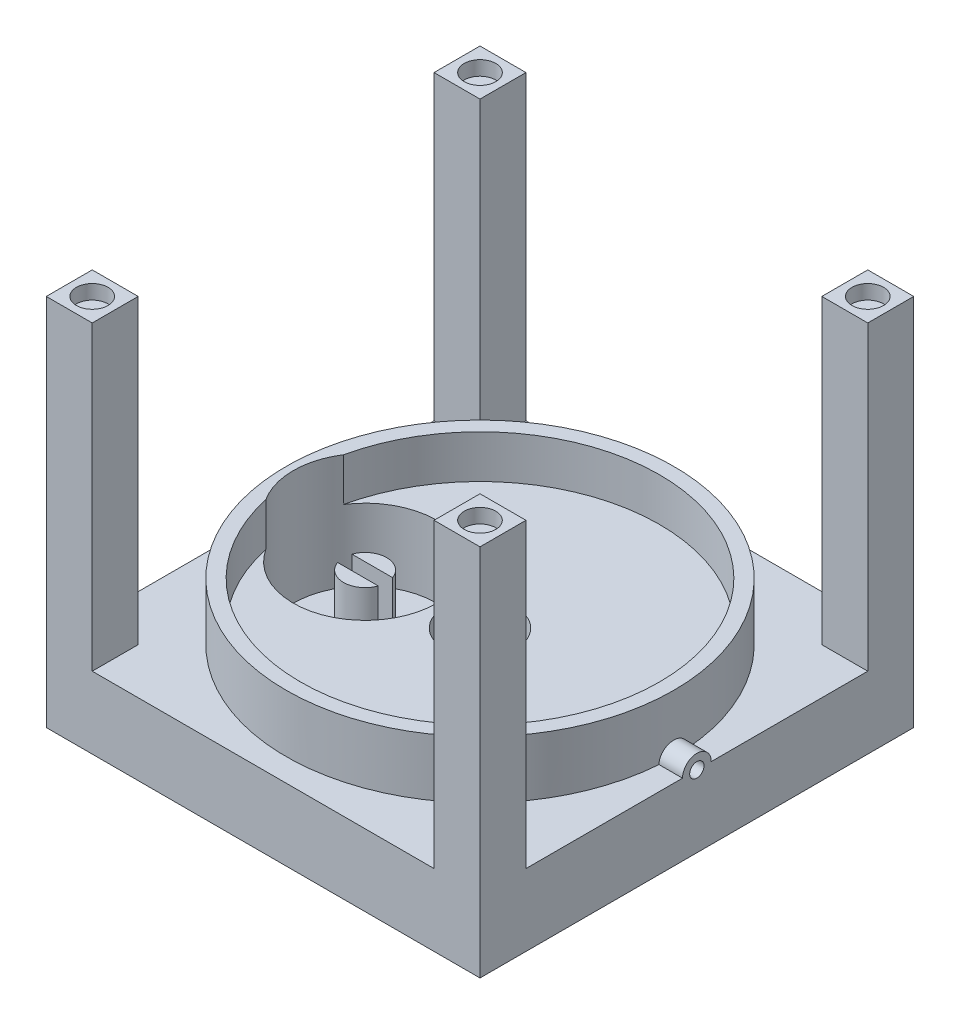
from build123d import *

# Parameters (mm, degrees)
SKETCH1_W               = 30.2
SKETCH1_H               = 30.2
BOSS_EXTRUDE1_DEPTH     = 5
SKETCH2_R               = 13.5
BOSS_EXTRUDE2_DEPTH     = 1
SKETCH3_R               = 2.5
CUT_EXTRUDE1_DEPTH      = 4.5
SKETCH4_R               = 13.5
SKETCH4_R_2             = 12.5
BOSS_EXTRUDE3_DEPTH     = 3
CUT_EXTRUDE2_DEPTH      = 5
CUT_EXTRUDE2_DEPTH_BACK = 5
SKETCH5_R               = 5
BOSS_EXTRUDE4_DEPTH     = 4.5
SKETCH7_R               = 1
SKETCH7_R_2             = 0.5
CUT_SWEEP1_START        = 4.580551388
CUT_SWEEP1_OUTLINE_R    = 0.5
CUT_SWEEP1_DEPTH        = 18.125062915
SKETCH10_R              = 2.5
CUT_EXTRUDE3_DEPTH      = 3
SKETCH12_W              = 3.2
SKETCH12_H              = 3.2
BOSS_EXTRUDE5_DEPTH     = 21
SKETCH15_R              = 1.1
CUT_EXTRUDE4_DEPTH      = 1


# Read off the part's stored shape, not the designer's step: Cut-Sweep1
with BuildPart() as part:
    # Sketch1 → Boss-Extrude1 (new body)
    with BuildSketch(Plane(origin=(0, 0, 0), x_dir=(1, 0, 0), z_dir=(0, 1, 0))):
        with Locations((7.605614303, 19.014035757)):
            Rectangle(SKETCH1_W, SKETCH1_H)
    extrude(amount=BOSS_EXTRUDE1_DEPTH)

    # Sketch2 → Boss-Extrude2 (add)
    with BuildSketch(Plane(origin=(0, 5, 0), x_dir=(1, 0, 0), z_dir=(0, 1, 0))):
        with Locations(Location((7.605614303, 19.014035757, 0), (0, 0, 270))):
            Circle(SKETCH2_R)
    extrude(amount=BOSS_EXTRUDE2_DEPTH)

    # Sketch3 → Cut-Extrude1 (cut)
    with BuildSketch(Plane(origin=(0, 6, 0), x_dir=(1, 0, 0), z_dir=(0, 1, 0))):
        with Locations(Location((7.605614303, 19.014035757, 0), (0, 0, 270))):
            Circle(SKETCH3_R)
    extrude(amount=-CUT_EXTRUDE1_DEPTH, mode=Mode.SUBTRACT)

    # Sketch4 → Boss-Extrude3 (add)
    with BuildSketch(Plane(origin=(0, 6, 0), x_dir=(1, 0, 0), z_dir=(0, 1, 0))):
        with Locations(Location((7.605614303, 19.014035757, 0), (0, 0, 270))):
            Circle(SKETCH4_R)
        with Locations(Location((7.605614303, 19.014035757, 0), (0, 0, 270))):
            Circle(SKETCH4_R_2, mode=Mode.SUBTRACT)
    extrude(amount=BOSS_EXTRUDE3_DEPTH)

    # Sketch5 → Cut-Extrude2 (cut, two sides: drawn at the far end of the back side and taken through both)
    with BuildSketch(Plane(origin=(0, 6, 0), x_dir=(1, 0, 0), z_dir=(0, 1, 0)).offset(-CUT_EXTRUDE2_DEPTH_BACK)):
        with Locations(Location((-0.394385697, 19.014035757, 0), (0, 0, 147.20617704))):
            Circle(SKETCH5_R)
    extrude(amount=CUT_EXTRUDE2_DEPTH + CUT_EXTRUDE2_DEPTH_BACK, mode=Mode.SUBTRACT)

    # Sketch6 → Boss-Extrude4 (add)
    with BuildSketch(Plane(origin=(0, 1, 0), x_dir=(1, 0, 0), z_dir=(0, 1, 0))):
        with BuildLine():
            ThreePointArc((1.019827865, 19.514035757), (-0.394385697, 20.514035757), (-1.80859926, 19.514035757))
            Line((-1.80859926, 19.514035757), (1.019827865, 19.514035757))
        make_face()
        with BuildLine():
            Line((1.019827865, 18.514035757), (-1.80859926, 18.514035757))
            ThreePointArc((-1.80859926, 18.514035757), (-0.394385697, 17.514035757), (1.019827865, 18.514035757))
        make_face()
    extrude(amount=BOSS_EXTRUDE4_DEPTH)

    # Sweep1: sweep along a path in Sketch8
    with BuildLine(Plane(origin=(0, 5, 0), x_dir=(1, 0, 0), z_dir=(0, 1, 0))) as sweep1_path:
        Line((22.705614303, 19.014035757), (4.605614303, 19.014035757))
    # Sketch7 → Sweep1 (sweep)
    with BuildSketch(Plane(origin=(22.705614303, 0, 0), x_dir=(0, 0, -1), z_dir=(1, 0, 0))):
        with Locations((19.014035757, 5)):
            Circle(SKETCH7_R)
        with Locations((19.014035757, 5)):
            Circle(SKETCH7_R_2, mode=Mode.SUBTRACT)
    sweep(path=sweep1_path.line)

    # Cut-Sweep1 outline → Cut-Sweep1 (cut)
    with BuildSketch(Plane.YZ.offset(CUT_SWEEP1_START)):
        with Locations((5, -19.014035757)):
            Circle(CUT_SWEEP1_OUTLINE_R)
    extrude(amount=CUT_SWEEP1_DEPTH, mode=Mode.SUBTRACT)

    # Sketch10 → Cut-Extrude3 (cut)
    with BuildSketch(Plane(origin=(0, 6, 0), x_dir=(1, 0, 0), z_dir=(0, 1, 0))):
        with Locations(Location((7.605614303, 19.014035757, 0), (0, 0, 270))):
            Circle(SKETCH10_R)
    extrude(amount=-CUT_EXTRUDE3_DEPTH, mode=Mode.SUBTRACT)

    # Sketch12 → Boss-Extrude5 (add)
    with BuildSketch(Plane(origin=(0, 5, 0), x_dir=(1, 0, 0), z_dir=(0, 1, 0))):
        with Locations((-5.894385697, 5.514035757)):
            Rectangle(SKETCH12_W, SKETCH12_H)
        with Locations((21.105614303, 5.514035757)):
            Rectangle(SKETCH12_W, SKETCH12_H)
        with Locations((21.105614303, 32.514035757)):
            Rectangle(SKETCH12_W, SKETCH12_H)
        with Locations((-5.894385697, 32.514035757)):
            Rectangle(SKETCH12_W, SKETCH12_H)
    extrude(amount=BOSS_EXTRUDE5_DEPTH)

    # Sketch15 → Cut-Extrude4 (cut)
    with BuildSketch(Plane(origin=(0, 26, 0), x_dir=(1, 0, 0), z_dir=(0, 1, 0))):
        with Locations(Location((-5.894385697, 5.514035757, 0), (0, 0, 270))):
            Circle(SKETCH15_R)
        with Locations(Location((-5.894385697, 32.514035757, 0), (0, 0, 270))):
            Circle(SKETCH15_R)
        with Locations(Location((21.105614303, 32.514035757, 0), (0, 0, 270))):
            Circle(SKETCH15_R)
        with Locations(Location((21.105614303, 5.514035757, 0), (0, 0, 270))):
            Circle(SKETCH15_R)
    extrude(amount=-CUT_EXTRUDE4_DEPTH, mode=Mode.SUBTRACT)


solid = part.part
